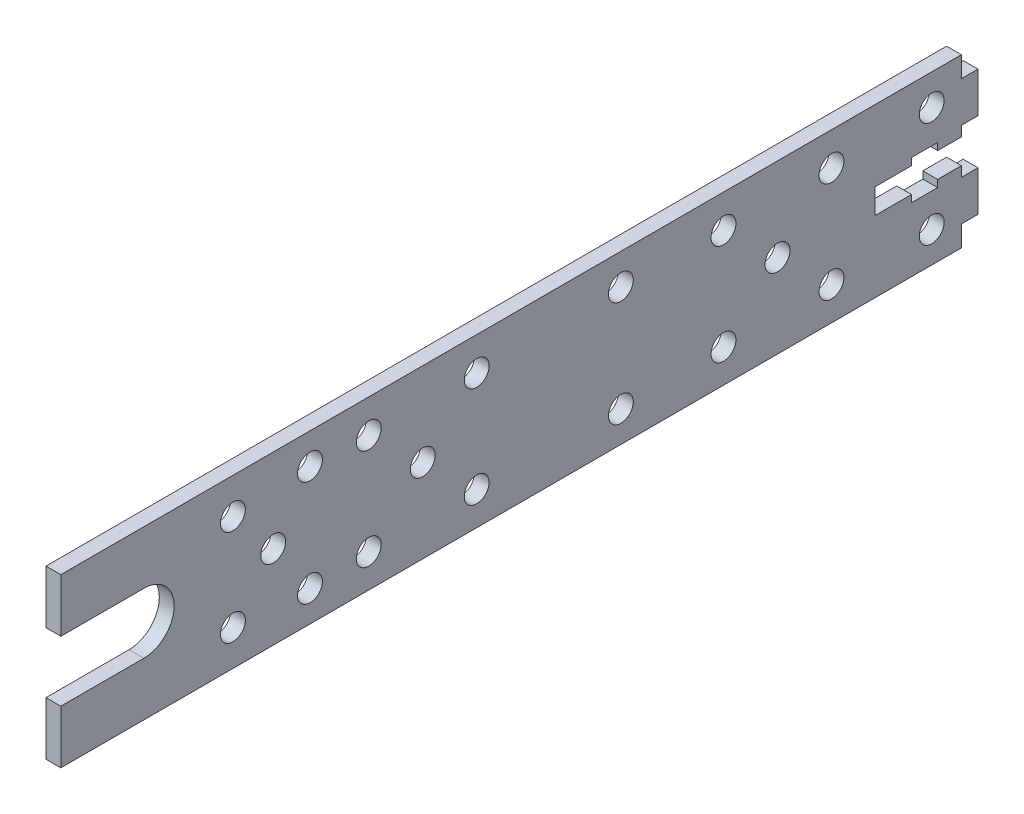
from build123d import *

# Parameters (mm, degrees)
SKETCH1_R           = 2.667
BOSS_EXTRUDE1_DEPTH = 1.5875


with BuildPart() as part:
    # Sketch1 → Boss-Extrude1 (new, symmetric)
    with BuildSketch(Plane(origin=(0, 0, 0), x_dir=(0, 0, -1), z_dir=(1, 0, 0))):
        with BuildLine():
            Line((94.615, 17.907), (-98.171, 17.907))
            Line((-98.171, 17.907), (-98.171, 6.477))
            Line((-98.171, 6.477), (-80.391, 6.477))
            ThreePointArc((-80.391, 6.477), (-73.914, 0), (-80.391, -6.477))
            Line((-80.391, -6.477), (-98.171, -6.477))
            Line((-98.171, -6.477), (-98.171, -17.907))
            Line((-98.171, -17.907), (94.615, -17.907))
            Line((94.615, -17.907), (94.615, -13.462))
            Line((94.615, -13.462), (98.171, -13.462))
            Line((98.171, -13.462), (98.171, -4.826))
            Line((98.171, -4.826), (94.615, -4.826))
            Line((94.615, -4.826), (94.615, -2.667))
            Line((94.615, -2.667), (89.535, -2.667))
            Line((89.535, -2.667), (89.535, -4.191))
            Line((89.535, -4.191), (83.947, -4.191))
            Line((83.947, -4.191), (83.947, -2.667))
            Line((83.947, -2.667), (76.073, -2.667))
            Line((76.073, -2.667), (76.073, 2.667))
            Line((76.073, 2.667), (83.947, 2.667))
            Line((83.947, 2.667), (83.947, 4.191))
            Line((83.947, 4.191), (89.535, 4.191))
            Line((89.535, 4.191), (89.535, 2.667))
            Line((89.535, 2.667), (94.615, 2.667))
            Line((94.615, 2.667), (94.615, 4.826))
            Line((94.615, 4.826), (98.171, 4.826))
            Line((98.171, 4.826), (98.171, 13.462))
            Line((98.171, 13.462), (94.615, 13.462))
            Line((94.615, 13.462), (94.615, 17.907))
        make_face()
        with Locations((-61.341, -10.287)):
            Circle(SKETCH1_R, mode=Mode.SUBTRACT)
        with Locations((-44.831, -11.303)):
            Circle(SKETCH1_R, mode=Mode.SUBTRACT)
        with Locations((-32.258, -10.795)):
            Circle(SKETCH1_R, mode=Mode.SUBTRACT)
        with Locations((-9.144, -10.795)):
            Circle(SKETCH1_R, mode=Mode.SUBTRACT)
        with Locations((-52.705, 0)):
            Circle(SKETCH1_R, mode=Mode.SUBTRACT)
        with Locations((-20.701, 0)):
            Circle(SKETCH1_R, mode=Mode.SUBTRACT)
        with Locations((21.717, -11.303)):
            Circle(SKETCH1_R, mode=Mode.SUBTRACT)
        with Locations((43.688, -10.795)):
            Circle(SKETCH1_R, mode=Mode.SUBTRACT)
        with Locations((66.802, -10.795)):
            Circle(SKETCH1_R, mode=Mode.SUBTRACT)
        with Locations((88.265, -11.303)):
            Circle(SKETCH1_R, mode=Mode.SUBTRACT)
        with Locations((55.245, 0)):
            Circle(SKETCH1_R, mode=Mode.SUBTRACT)
        with Locations((-61.341, 10.287)):
            Circle(SKETCH1_R, mode=Mode.SUBTRACT)
        with Locations((-32.258, 10.795)):
            Circle(SKETCH1_R, mode=Mode.SUBTRACT)
        with Locations((-44.831, 11.303)):
            Circle(SKETCH1_R, mode=Mode.SUBTRACT)
        with Locations((-9.144, 10.795)):
            Circle(SKETCH1_R, mode=Mode.SUBTRACT)
        with Locations((21.717, 11.303)):
            Circle(SKETCH1_R, mode=Mode.SUBTRACT)
        with Locations((43.688, 10.795)):
            Circle(SKETCH1_R, mode=Mode.SUBTRACT)
        with Locations((66.802, 10.795)):
            Circle(SKETCH1_R, mode=Mode.SUBTRACT)
        with Locations((88.265, 11.303)):
            Circle(SKETCH1_R, mode=Mode.SUBTRACT)
    extrude(amount=BOSS_EXTRUDE1_DEPTH, both=True)


solid = part.part
